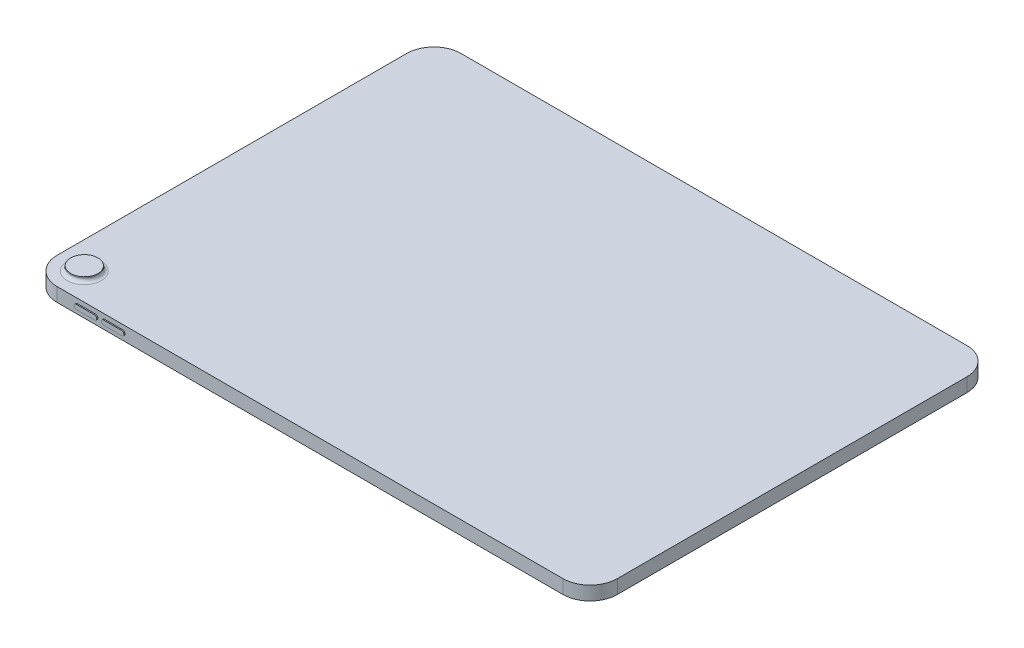
from build123d import *

# Parameters (mm, degrees)
SKIZZE1_W                       = 247.6
SKIZZE1_H                       = 178.5
AUFSATZ_LINEAR_AUSTRAGEN1_DEPTH = 6.1
VERRUNDUNG1_R                   = 12
SKIZZE2_R                       = 6
AUFSATZ_LINEAR_AUSTRAGEN2_DEPTH = 2
VERRUNDUNG2_R                   = 1.5
AUFSATZ_LINEAR_AUSTRAGEN3_DEPTH = 0.5
AUFSATZ_LINEAR_AUSTRAGEN5_DEPTH = 0.5


with BuildPart() as part:
    # Skizze1 → Aufsatz-Linear austragen1 (new body)
    with BuildSketch(Plane(origin=(0, 0, 0), x_dir=(1, 0, 0), z_dir=(0, 1, 0))):
        Rectangle(SKIZZE1_W, SKIZZE1_H)
    extrude(amount=AUFSATZ_LINEAR_AUSTRAGEN1_DEPTH)

    # Verrundung1
    verrundung1_edges = [part.edges().sort_by_distance(p)[0] for p in [
        (-123.8, 3.05, -89.25),
        (-123.8, 3.05, 89.25),
        (123.8, 3.05, -89.25),
        (123.8, 3.05, 89.25),
    ]]
    fillet(verrundung1_edges, radius=VERRUNDUNG1_R)

    # Skizze2 → Aufsatz-Linear austragen2 (add)
    with BuildSketch(Plane(origin=(0, 6.1, 0), x_dir=(1, 0, 0), z_dir=(0, 1, 0))):
        with Locations((-111.8, -77.25)):
            Circle(SKIZZE2_R)
    extrude(amount=AUFSATZ_LINEAR_AUSTRAGEN2_DEPTH)

    # Verrundung2
    verrundung2_edges = [part.edges().sort_by_distance(p)[0] for p in [
        (-117.8, 6.1, 77.25),
    ]]
    fillet(verrundung2_edges, radius=VERRUNDUNG2_R)

    # Skizze3 → Aufsatz-Linear austragen3 (add)
    with BuildSketch(Plane.ZY.offset(123.8)):
        with BuildLine():
            Line((74.4, 1.2), (61.1, 1.2))
            ThreePointArc((61.1, 1.2), (59.25, 3.05), (61.1, 4.9))
            Line((61.1, 4.9), (74.4, 4.9))
            ThreePointArc((74.4, 4.9), (76.25, 3.05), (74.4, 1.2))
        make_face()
    extrude(amount=AUFSATZ_LINEAR_AUSTRAGEN3_DEPTH)

    # Skizze4 → Aufsatz-Linear austragen5 (add)
    with BuildSketch(Plane.XY.offset(89.25)):
        with BuildLine():
            Line((-102.8, 4.05), (-94.8, 4.05))
            ThreePointArc((-94.8, 4.05), (-93.8, 3.05), (-94.8, 2.05))
            Line((-94.8, 2.05), (-102.8, 2.05))
            ThreePointArc((-102.8, 2.05), (-103.8, 3.05), (-102.8, 4.05))
        make_face()
        with BuildLine():
            Line((-90.8, 4.05), (-82.8, 4.05))
            ThreePointArc((-82.8, 4.05), (-81.8, 3.05), (-82.8, 2.05))
            Line((-82.8, 2.05), (-90.8, 2.05))
            ThreePointArc((-90.8, 2.05), (-91.8, 3.05), (-90.8, 4.05))
        make_face()
    extrude(amount=AUFSATZ_LINEAR_AUSTRAGEN5_DEPTH)


solid = part.part
